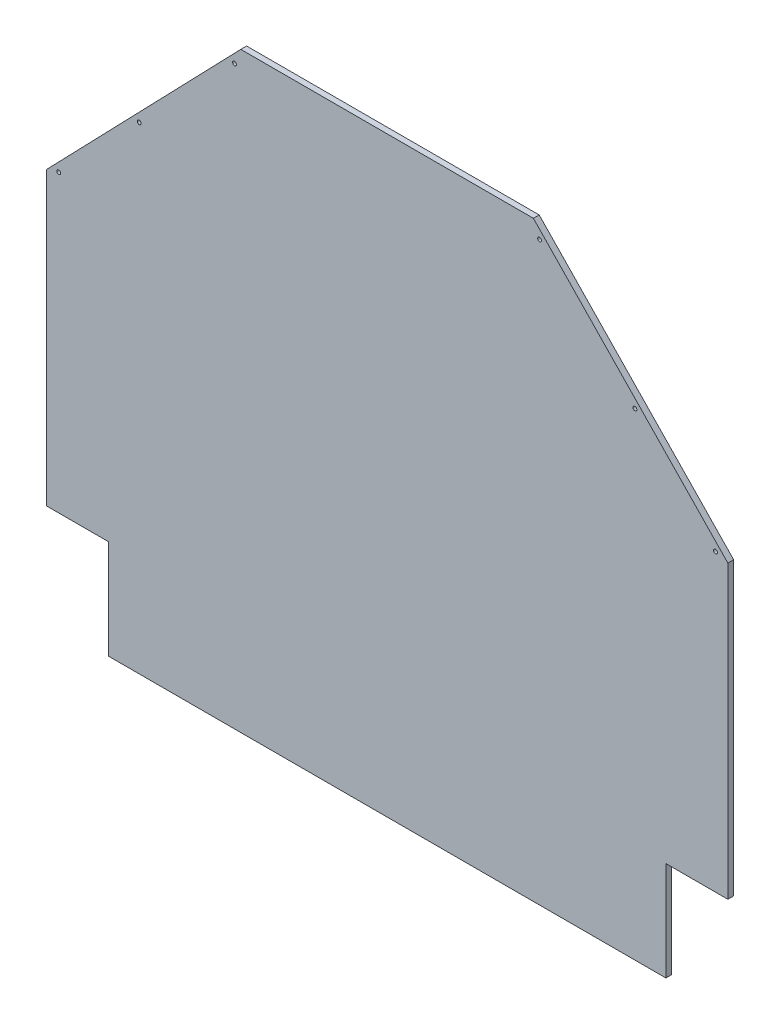
from build123d import *

# Parameters (mm, degrees)
BOSS_EXTRUDE1_DEPTH            = 11.90625
F_5_16_0_3125_DIAMETER_HOLE1_D = 7.9375


with BuildPart() as part:
    # Sketch1 → Boss-Extrude1 (new body)
    with BuildSketch(Plane.XY):
        Polygon((1068.467396061, -524.104266958), (941.467396061, -524.104266958), (941.467396061, -727.304266958), (-201.532603939, -727.304266958), (-201.532603939, -524.104266958), (-328.532603939, -524.104266958), (-328.532603939, 72.795733042), (70.055437863, 485.545733042), (669.87935426, 485.545733042), (1068.467396061, 72.795733042), align=None)
    extrude(amount=BOSS_EXTRUDE1_DEPTH)

    # 5/16 (0.3125) Diameter Hole1 (through all)
    with Locations(Plane.XY.offset(11.90625)):
        with Locations((-303.132603939, 80.815834959), (-138.032603939, 251.781889765), (57.355437863, 454.112130003), (682.57935426, 454.112130003), (877.967396061, 251.781889765), (1043.067396061, 80.815834959)):
            Hole(F_5_16_0_3125_DIAMETER_HOLE1_D / 2)


solid = part.part
